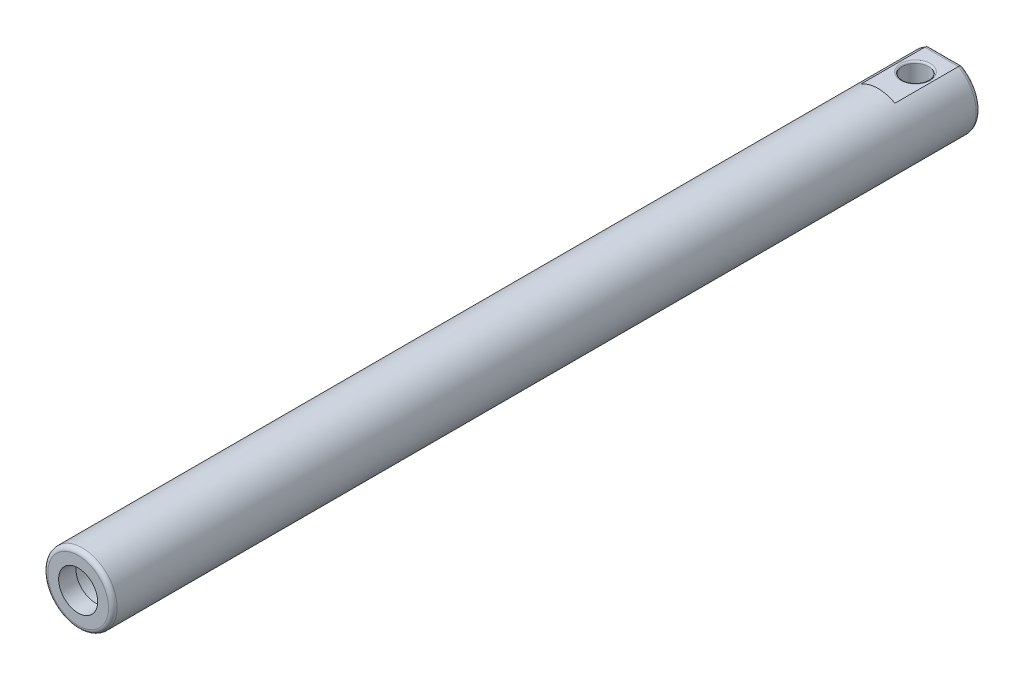
from build123d import *

# Parameters (mm, degrees)
SKETCH2_R           = 40
BOSS_EXTRUDE1_DEPTH = 920
SKETCH3_R           = 30
CUT_EXTRUDE1_DEPTH  = 900
CUT_EXTRUDE2_REACH  = 923.737
SKETCH4_R           = 22.5
BOSS_EXTRUDE2_START = 80
SKETCH5_R           = 40
BOSS_EXTRUDE2_DEPTH = 80
SKETCH6_W           = 40
SKETCH6_H           = 78
CUT_EXTRUDE3_DEPTH  = 5
SKETCH7_R           = 15
CUT_EXTRUDE4_DEPTH  = 924.91828643
FILLET2_R           = 5
FILLET3_R           = 2


with BuildPart() as part:
    # Sketch2 → Boss-Extrude1 (new body)
    with BuildSketch(Plane.XY):
        Circle(SKETCH2_R)
    extrude(amount=BOSS_EXTRUDE1_DEPTH)

    # Sketch3 → Cut-Extrude1 (cut)
    with BuildSketch(Plane(origin=(0, 0, 0), x_dir=(-1, 0, 0), z_dir=(0, 0, -1))):
        Circle(SKETCH3_R)
    extrude(amount=-CUT_EXTRUDE1_DEPTH, mode=Mode.SUBTRACT)

    # Sketch4 → Cut-Extrude2 (cut, up to next)
    with BuildSketch(Plane.XY.offset(920), mode=Mode.PRIVATE) as cut_extrude2_sk1:
        Circle(SKETCH4_R)
    cut_extrude2_tool1 = extrude(cut_extrude2_sk1.sketch, amount=-CUT_EXTRUDE2_REACH, mode=Mode.PRIVATE) & part.part
    add(cut_extrude2_tool1.solids().sort_by_distance((0, 0, 920))[0], mode=Mode.SUBTRACT)

    # Sketch5 → Boss-Extrude2 (add)
    with BuildSketch(Plane(origin=(0, 0, 0), x_dir=(-1, 0, 0), z_dir=(0, 0, -1)).offset(BOSS_EXTRUDE2_START)):
        Circle(SKETCH5_R)
    extrude(amount=-BOSS_EXTRUDE2_DEPTH)

    # Sketch6 → Cut-Extrude3 (cut)
    with BuildSketch(Plane(origin=(0, 40, 0), x_dir=(1, 0, 0), z_dir=(0, 1, 0))):
        with Locations((0, 41)):
            Rectangle(SKETCH6_W, SKETCH6_H)
    cut_extrude3 = extrude(amount=-CUT_EXTRUDE3_DEPTH, mode=Mode.SUBTRACT)

    # Mirror1: Cut-Extrude3 across plane
    add(cut_extrude3.mirror(Plane.ZX), mode=Mode.SUBTRACT)

    # Sketch7 → Cut-Extrude4 (cut, through all)
    with BuildSketch(Plane(origin=(0, 35, 0), x_dir=(1, 0, 0), z_dir=(0, 1, 0))):
        with Locations(Location((0, 45, 0), (0, 0, 270))):
            Circle(SKETCH7_R)
    extrude(amount=-CUT_EXTRUDE4_DEPTH, mode=Mode.SUBTRACT)

    # Fillet2
    fillet2_edges = [part.edges().sort_by_distance(p)[0] for p in [
        (40, 0, -80),
        (0, 35, -80),
        (-34.457195687, 20.315060063, -80),
        (0, -35, -80),
        (-40, 0, 920),
    ]]
    fillet(fillet2_edges, radius=FILLET2_R - 0.0001)  # a hair under: the kernel refuses the full size

    # Fillet3
    fillet3_edges = [part.edges().sort_by_distance(p)[0] for p in [
        (0, -35, -60),
        (0, 35, -60),
    ]]
    fillet(fillet3_edges, radius=FILLET3_R)


solid = part.part
